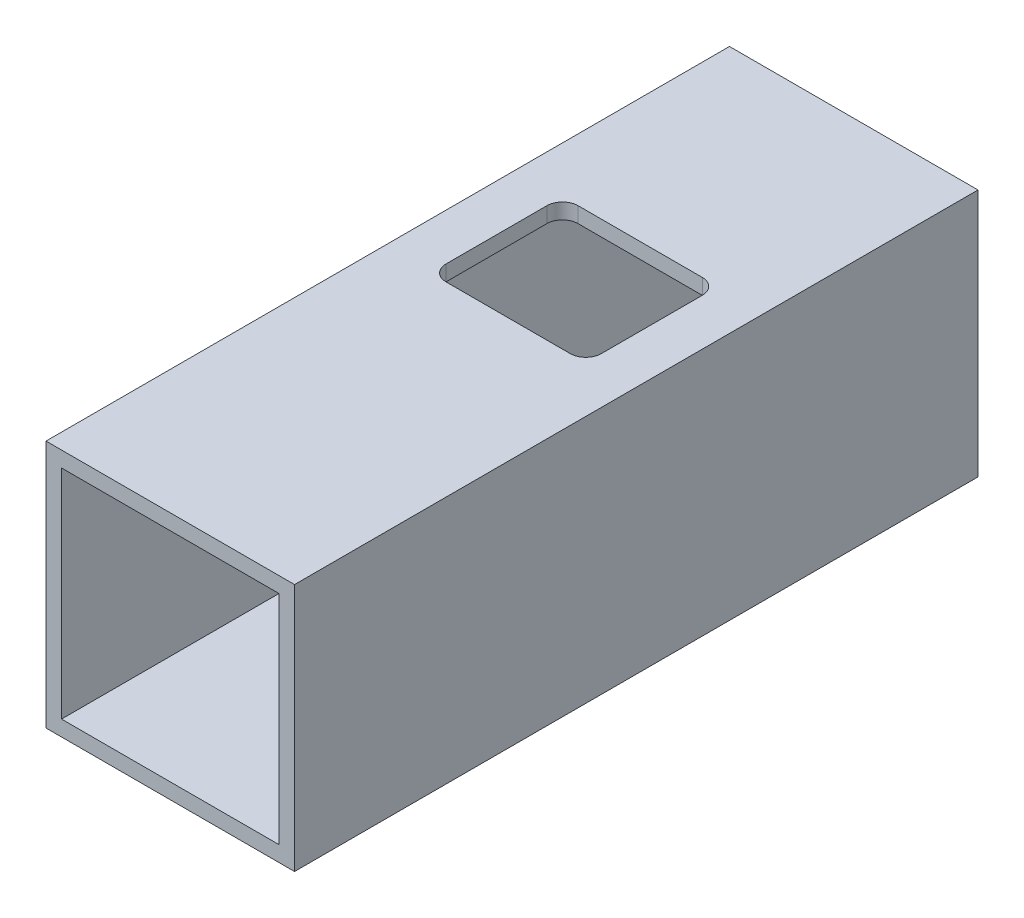
from build123d import *

# Parameters (mm, degrees)
SKETCH1_W           = 50.8
SKETCH1_H           = 50.8
BOSS_EXTRUDE1_DEPTH = 69.85
SHELL1_T            = -3.175
SKETCH2_W           = 31.75
SKETCH2_H           = 26.9875
CUT_EXTRUDE1_DEPTH  = 79.545162168
FILLET1_R           = 3.175


with BuildPart() as part:
    # Sketch1 → Boss-Extrude1 (new, symmetric)
    with BuildSketch(Plane.XY):
        Rectangle(SKETCH1_W, SKETCH1_H)
    extrude(amount=BOSS_EXTRUDE1_DEPTH, both=True)

    # Shell1
    shell1_openings = [part.faces().sort_by_distance(p)[0] for p in [
        (0, 0, -69.85),
        (0, 0, 69.85),
    ]]
    offset(amount=SHELL1_T, openings=shell1_openings, kind=Kind.INTERSECTION)

    # Sketch2 → Cut-Extrude1 (cut, through all)
    with BuildSketch(Plane(origin=(0, 0, 0), x_dir=(1, 0, 0), z_dir=(0, 1, 0))):
        with Locations((0, 12.7)):
            Rectangle(SKETCH2_W, SKETCH2_H)
    extrude(amount=CUT_EXTRUDE1_DEPTH, mode=Mode.SUBTRACT)

    # Fillet1
    fillet1_edges = [part.edges().sort_by_distance(p)[0] for p in [
        (15.875, 23.8125, -26.19375),
        (-15.875, 23.8125, -26.19375),
        (-15.875, 23.8125, 0.79375),
        (15.875, 23.8125, 0.79375),
    ]]
    fillet(fillet1_edges, radius=FILLET1_R)


solid = part.part
